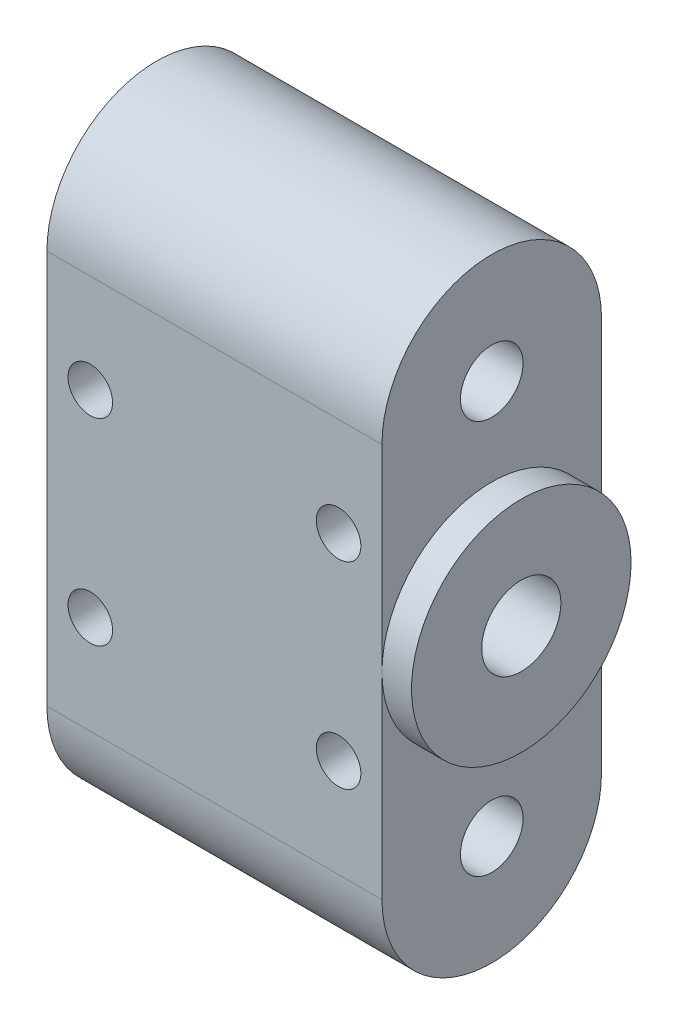
from build123d import *

# Parameters (mm, degrees)
BOSS_EXTRUDE1_DEPTH     = 21.59
SKETCH8_R               = 7.0739
BOSS_EXTRUDE2_DEPTH     = 1.905
F_1_4_20_TAPPED_HOLE1_D = 5.1054
F_10_32_TAPPED_HOLE1_D  = 4.0386
F_6_40_TAPPED_HOLE1_D   = 2.8702


with BuildPart() as part:
    # Sketch1 → Boss-Extrude1 (new body)
    with BuildSketch(Plane(origin=(0, 0, 0), x_dir=(0, 0, -1), z_dir=(1, 0, 0))):
        with BuildLine():
            Line((7.0739, 12.7), (7.0739, -12.7))
            ThreePointArc((7.0739, -12.7), (0, -19.7739), (-7.0739, -12.7))
            Line((-7.0739, -12.7), (-7.0739, 12.7))
            ThreePointArc((-7.0739, 12.7), (0, 19.7739), (7.0739, 12.7))
        make_face()
    extrude(amount=BOSS_EXTRUDE1_DEPTH)

    # Sketch8 → Boss-Extrude2 (add)
    with BuildSketch(Plane(origin=(21.59, 0, 0), x_dir=(0, 0, -1), z_dir=(1, 0, 0))):
        Circle(SKETCH8_R)
    extrude(amount=BOSS_EXTRUDE2_DEPTH)

    # 1/4-20 Tapped Hole1 (through all)
    with Locations(Plane(origin=(23.495, 0, 0), x_dir=(0, 0, -1), z_dir=(1, 0, 0))):
        with Locations((0, 0)):
            Hole(F_1_4_20_TAPPED_HOLE1_D / 2)

    # #10-32 Tapped Hole1 (through all)
    with Locations(Plane(origin=(21.59, 0, 0), x_dir=(0, 0, -1), z_dir=(1, 0, 0))):
        with Locations((0, 12.7), (0, -12.7)):
            Hole(F_10_32_TAPPED_HOLE1_D / 2)

    # #6-40 Tapped Hole1 (through all)
    with Locations(Plane.XY.offset(7.0739)):
        with Locations((2.795, 6.35), (18.795, 6.35), (2.795, -6.35), (18.795, -6.35)):
            Hole(F_6_40_TAPPED_HOLE1_D / 2)


solid = part.part
